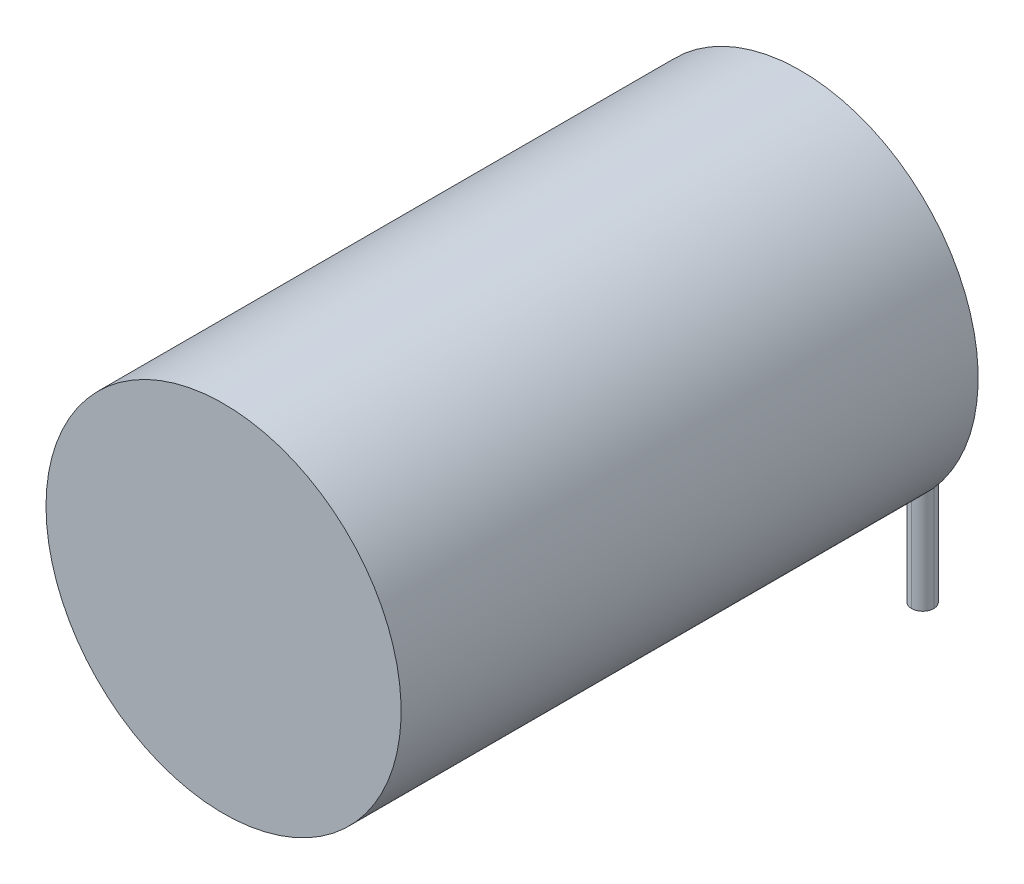
from build123d import *

# Parameters (mm, degrees)
SKETCH_1_R      = 4
EXTRUDE_1_DEPTH = 13
SKETCH_2_W      = 0.5
SKETCH_2_H      = 0.5
EXTRUDE_2_DEPTH = 1
SKETCH_3_W      = 0.5
SKETCH_3_H      = 0.5
EXTRUDE_3_DEPTH = 5.5
FILLET_1_R      = 0.25
FILLET_2_R      = 0.25


with BuildPart() as part:
    # Эскиз1 → Бобышка-Вытянуть1 (new body)
    with BuildSketch(Plane.XY):
        with Locations(Location((0, 0, 0), (0, 0, 180))):
            Circle(SKETCH_1_R)
    extrude(amount=EXTRUDE_1_DEPTH)

    # Эскиз2 → Бобышка-Вытянуть2 (add)
    with BuildSketch(Plane(origin=(0, 0, 0), x_dir=(-1, 0, 0), z_dir=(0, 0, -1))):
        with Locations((2, 0)):
            Rectangle(SKETCH_2_W, SKETCH_2_H)
        with Locations((-2, 0)):
            Rectangle(SKETCH_2_W, SKETCH_2_H)
    extrude(amount=EXTRUDE_2_DEPTH)

    # Эскиз3 → Бобышка-Вытянуть3 (add)
    with BuildSketch(Plane.XZ.offset(0.25)):
        with Locations((-2, -0.75)):
            Rectangle(SKETCH_3_W, SKETCH_3_H)
        with Locations((2, -0.75)):
            Rectangle(SKETCH_3_W, SKETCH_3_H)
    extrude(amount=EXTRUDE_3_DEPTH)

    # Скругление1
    fillet_1_edges = [part.edges().sort_by_distance(p)[0] for p in [
        (-1.75, -2.75, -1),
        (-2.25, -2.75, -1),
    ]]
    fillet(fillet_1_edges, radius=FILLET_1_R - 0.0001)  # a hair under: the kernel refuses the full size

    # Скругление2
    fillet_2_edges = [part.edges().sort_by_distance(p)[0] for p in [
        (-1.75, -0.25, -0.25),
        (-2.25, -0.25, -0.25),
        (-2.25, -3, -0.5),
        (-2, -0.25, -0.5),
        (-1.75, -3, -0.5),
        (1.75, -0.25, -0.25),
        (2.25, -0.25, -0.25),
        (1.75, -3, -0.5),
        (2, -0.25, -0.5),
        (2.25, -3, -0.5),
        (-1.75, 0.25, -0.37505),
        (-2.25, 0.25, -0.37505),
        (-2.176805985, 0.25, -0.926805985),
        (-1.823194015, 0.25, -0.926805985),
        (1.75, 0.25, -0.5),
        (2.25, 0.25, -0.5),
        (1.75, -2.75, -1),
        (2, 0.25, -1),
        (2.25, -2.75, -1),
    ]]
    fillet(fillet_2_edges, radius=FILLET_2_R - 0.0001)  # a hair under: the kernel refuses the full size


solid = part.part
